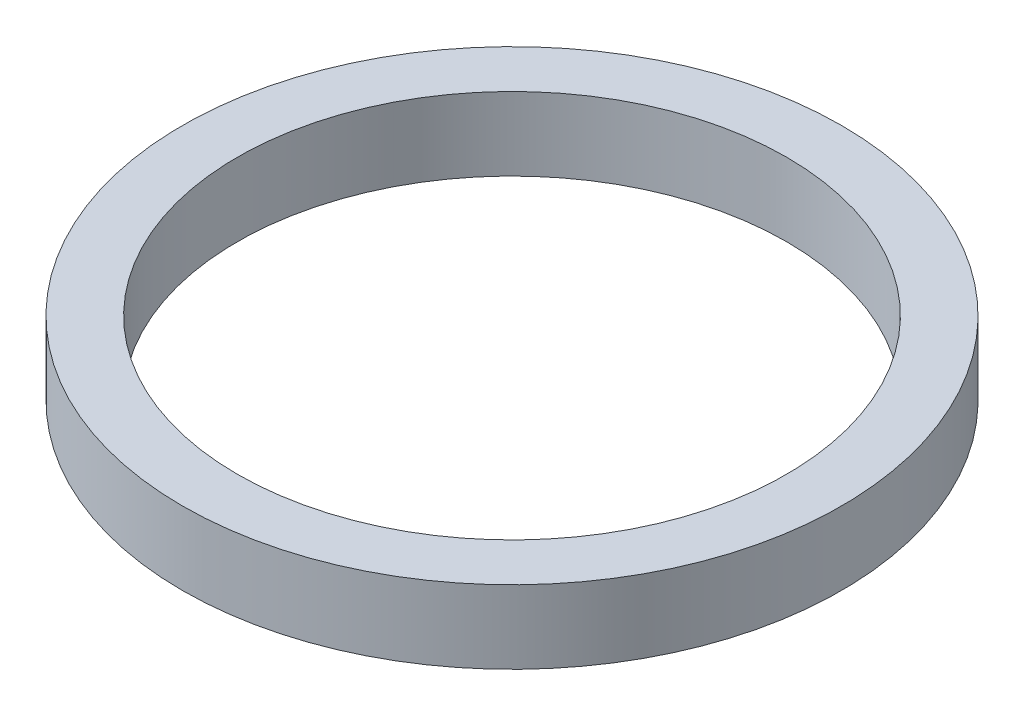
from build123d import *

# Parameters (mm, degrees)
SKETCH1_R           = 45
BOSS_EXTRUDE1_DEPTH = 10
SKETCH2_R           = 37.5
CUT_EXTRUDE1_DEPTH  = 65.420493634


with BuildPart() as part:
    # Sketch1 → Boss-Extrude1 (new body)
    with BuildSketch(Plane(origin=(0, 0, 0), x_dir=(1, 0, 0), z_dir=(0, 1, 0))):
        Circle(SKETCH1_R)
    extrude(amount=BOSS_EXTRUDE1_DEPTH)

    # Sketch2 → Cut-Extrude1 (cut, through all)
    with BuildSketch(Plane(origin=(0, 0, 0), x_dir=(1, 0, 0), z_dir=(0, 1, 0))):
        Circle(SKETCH2_R)
    extrude(amount=CUT_EXTRUDE1_DEPTH, mode=Mode.SUBTRACT)


solid = part.part
